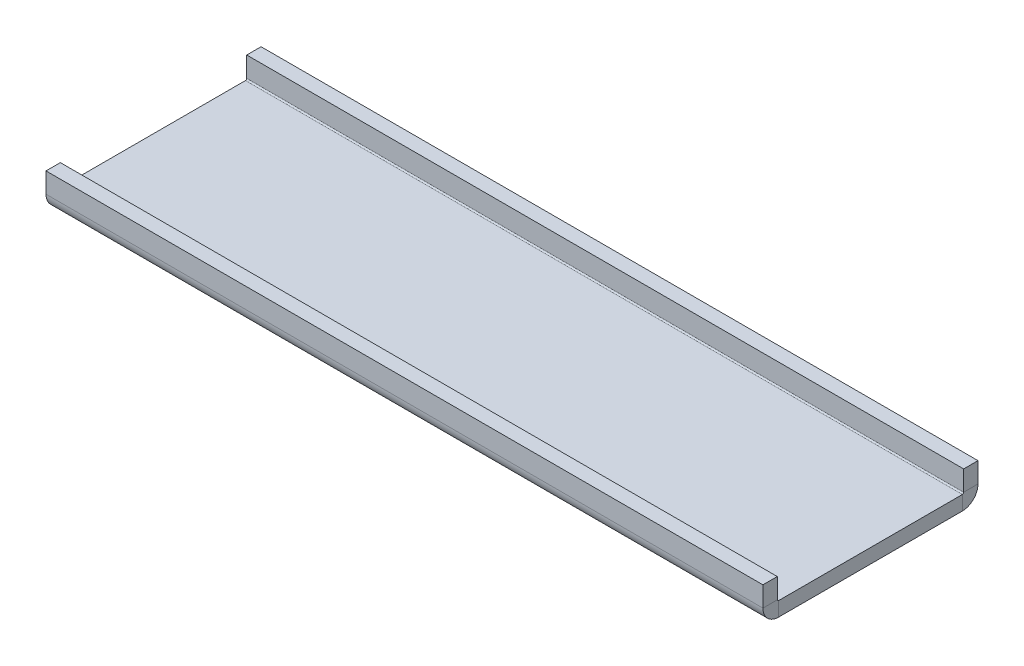
from build123d import *

# Parameters (mm, degrees)
SM_START                         = -4
SM_BASE_FLANGE_1_OUTLINE_W       = 400
SM_BASE_FLANGE_1_OUTLINE_H       = 120
SM_BASE_FLANGE_1_DEPTH           = 8
SM_EDGE_FLANGE_1_STRIP_W         = 33.4732
SM_EDGE_FLANGE_1_STRIP_H         = 8
SM_EDGE_FLANGE_1_STRIP_CUT_DEPTH = 400
SM_EDGE_FLANGE_1_DEPTH           = 400
SM_EDGE_FLANGE_2_STRIP_W         = 33.4732
SM_EDGE_FLANGE_2_STRIP_H         = 8
SM_EDGE_FLANGE_2_STRIP_CUT_DEPTH = 400
SM_EDGE_FLANGE_2_DEPTH           = 400


# Read off the part's stored shape, not the designer's step: 基体-法兰1
# Sheet-metal steps are written as plain solids
with BuildPart() as part:
    # 基体-法兰1 outline → 基体-法兰1 (new body)
    with BuildSketch(Plane(origin=(0, 0, 0), x_dir=(1, 0, 0), z_dir=(0, 1, 0)).offset(SM_START)):
        with Locations((0, 60)):
            Rectangle(SM_BASE_FLANGE_1_OUTLINE_W, SM_BASE_FLANGE_1_OUTLINE_H)
    extrude(amount=SM_BASE_FLANGE_1_DEPTH)

    # 边线-法兰1 strip (across the edge) → 边线-法兰1 strip cut (cut)
    with BuildSketch(Plane(origin=(-200, 4, 0), x_dir=(0, 0, -1), z_dir=(1, 0, 0))):
        with Locations((-8, -4)):
            Rectangle(SM_EDGE_FLANGE_1_STRIP_W, SM_EDGE_FLANGE_1_STRIP_H)
    extrude(amount=SM_EDGE_FLANGE_1_STRIP_CUT_DEPTH, mode=Mode.SUBTRACT)

    # 边线-法兰1 section (across the edge) → 边线-法兰1 (add)
    with BuildSketch(Plane(origin=(-200, 4, 0), x_dir=(0, 0, -1), z_dir=(1, 0, 0))):
        with BuildLine():
            Line((0, 0.7366), (0, 12))
            Line((0, 12), (8, 12))
            Line((8, 12), (8, 0.7366))
            ThreePointArc((8, 0.7366), (8.215745145, 0.215745145), (8.7366, 0))
            Line((8.7366, 0), (8.7366, -8))
            ThreePointArc((8.7366, -8), (2.558890895, -5.441109105), (0, 0.7366))
        make_face()
    extrude(amount=SM_EDGE_FLANGE_1_DEPTH)

    # 边线-法兰2 strip (across the edge) → 边线-法兰2 strip cut (cut)
    with BuildSketch(Plane(origin=(200, 4, -120), x_dir=(0, 0, 1), z_dir=(-1, 0, 0))):
        with Locations((-8, -4)):
            Rectangle(SM_EDGE_FLANGE_2_STRIP_W, SM_EDGE_FLANGE_2_STRIP_H)
    extrude(amount=SM_EDGE_FLANGE_2_STRIP_CUT_DEPTH, mode=Mode.SUBTRACT)

    # 边线-法兰2 section (across the edge) → 边线-法兰2 (add)
    with BuildSketch(Plane(origin=(200, 4, -120), x_dir=(0, 0, 1), z_dir=(-1, 0, 0))):
        with BuildLine():
            Line((0, 0.7366), (0, 12))
            Line((0, 12), (8, 12))
            Line((8, 12), (8, 0.7366))
            ThreePointArc((8, 0.7366), (8.215745145, 0.215745145), (8.7366, 0))
            Line((8.7366, 0), (8.7366, -8))
            ThreePointArc((8.7366, -8), (2.558890895, -5.441109105), (0, 0.7366))
        make_face()
    extrude(amount=SM_EDGE_FLANGE_2_DEPTH)


solid = part.part
